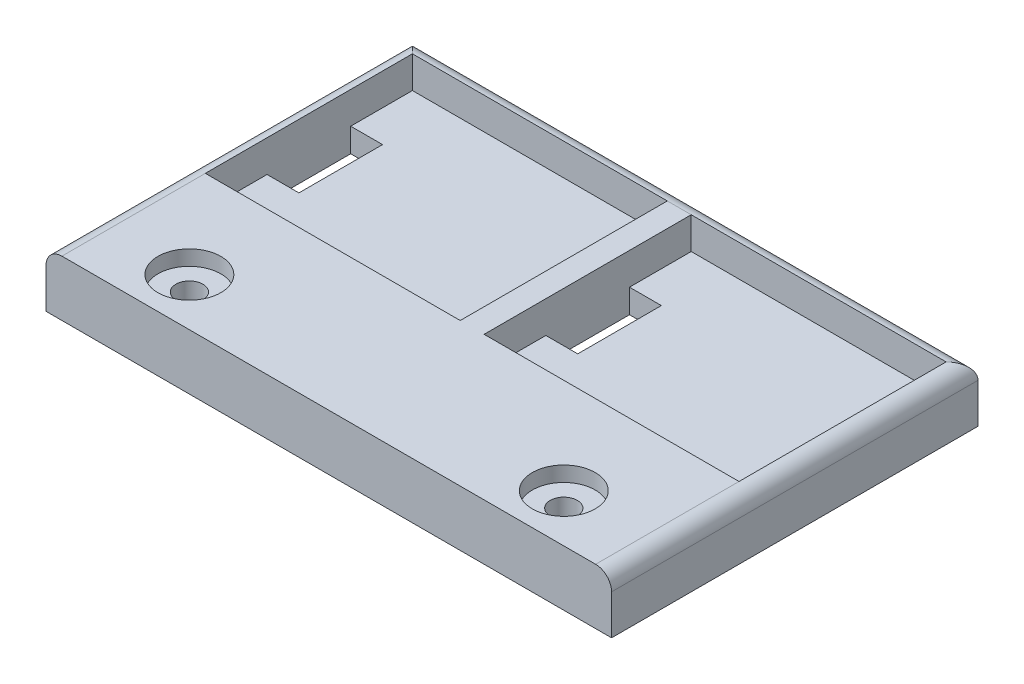
from build123d import *

# Parameters (mm, degrees)
SKETCH1_W                                     = 71
SKETCH1_H                                     = 46
BOSS_EXTRUDE1_DEPTH                           = 7
SKETCH2_W                                     = 32
SKETCH2_H                                     = 26
CUT_EXTRUDE1_DEPTH                            = 4
CBORE_FOR_M3_MUSHROOM_HEAD_SCREW1_D           = 3.4
CBORE_FOR_M3_MUSHROOM_HEAD_SCREW1_CBORE_D     = 7.9
CBORE_FOR_M3_MUSHROOM_HEAD_SCREW1_CBORE_DEPTH = 1.9
CUT_EXTRUDE2_DEPTH                            = 43.488233665
CUT_EXTRUDE2_DEPTH_BACK                       = 43.488233665
SKETCH6_W                                     = 4
SKETCH6_H                                     = 10.5
FILLET1_START                                 = -23
FILLET1_DEPTH                                 = 47
FILLET1_START_2                               = -36
FILLET1_2_DEPTH                               = 72
SKETCH8_W                                     = 0.314102564
SKETCH8_H                                     = 3.5
BOSS_EXTRUDE2_DEPTH                           = 0.5
BOSS_EXTRUDE3_DEPTH                           = 0.3


with BuildPart() as part:
    # Sketch1 → Boss-Extrude1 (new body)
    with BuildSketch(Plane(origin=(0, 0, 0), x_dir=(1, 0, 0), z_dir=(0, 1, 0))):
        Rectangle(SKETCH1_W, SKETCH1_H)
    extrude(amount=BOSS_EXTRUDE1_DEPTH)

    # Sketch2 → Cut-Extrude1 (cut)
    with BuildSketch(Plane(origin=(0, 7, 0), x_dir=(1, 0, 0), z_dir=(0, 1, 0))):
        with Locations((-17.5, 8)):
            Rectangle(SKETCH2_W, SKETCH2_H)
        with Locations((17.5, 8)):
            Rectangle(SKETCH2_W, SKETCH2_H)
    extrude(amount=-CUT_EXTRUDE1_DEPTH, mode=Mode.SUBTRACT)

    # CBORE for M3 Mushroom Head Screw1 (through all)
    with Locations(Plane(origin=(0, 7, 0), x_dir=(1, 0, 0), z_dir=(0, 1, 0))):
        with Locations((-23.5, -17), (23.5, -17)):
            CounterBoreHole(CBORE_FOR_M3_MUSHROOM_HEAD_SCREW1_D / 2, CBORE_FOR_M3_MUSHROOM_HEAD_SCREW1_CBORE_D / 2, CBORE_FOR_M3_MUSHROOM_HEAD_SCREW1_CBORE_DEPTH)

    # Sketch6 → Cut-Extrude2 (cut, two sides: drawn at the far end of the back side and taken through both)
    with BuildSketch(Plane(origin=(0, 3, 0), x_dir=(1, 0, 0), z_dir=(0, 1, 0)).offset(-CUT_EXTRUDE2_DEPTH_BACK)):
        with Locations((-31.5, 8)):
            Rectangle(SKETCH6_W, SKETCH6_H)
        with Locations((-3.5, 8)):
            Rectangle(SKETCH6_W, SKETCH6_H)
        with Locations((3.5, 8)):
            Rectangle(SKETCH6_W, SKETCH6_H)
        with Locations((31.5, 8)):
            Rectangle(SKETCH6_W, SKETCH6_H)
    extrude(amount=CUT_EXTRUDE2_DEPTH + CUT_EXTRUDE2_DEPTH_BACK, mode=Mode.SUBTRACT)

    # Fillet1: read off the stored shape, not the designer's step
    # Fillet1 outline → Fillet1 (cut)
    with BuildSketch(Plane.XY.offset(FILLET1_START)):
        with BuildLine():
            Line((35.5, 7), (33.5, 7))
            ThreePointArc((33.5, 7), (34.914213562, 6.414213562), (35.5, 5))
            Line((35.5, 5), (35.5, 7))
        make_face()
        with BuildLine():
            ThreePointArc((-35.5, 5), (-34.914213562, 6.414213562), (-33.5, 7))
            Line((-33.5, 7), (-35.5, 7))
            Line((-35.5, 7), (-35.5, 5))
        make_face()
    extrude(amount=FILLET1_DEPTH, mode=Mode.SUBTRACT)

    # Fillet1 2 outline → Fillet1 2 (cut)
    with BuildSketch(Plane.YZ.offset(FILLET1_START_2)):
        with BuildLine():
            Line((7, -23), (7, -21))
            ThreePointArc((7, -21), (6.414213562, -22.414213562), (5, -23))
            Line((5, -23), (7, -23))
        make_face()
    extrude(amount=FILLET1_2_DEPTH, mode=Mode.SUBTRACT)

    # Sketch8 → Boss-Extrude2 (add)
    # profile 1 of 6: a face of its own
    with BuildSketch(Plane(origin=(0, 0, 0), x_dir=(1, 0, 0), z_dir=(0, 1, 0))):
        Polygon((-15.099358974, 15.715515127), (-15.099358974, 19.215515127), (-15.165264423, 19.215515127), (-17.477564103, 16.460807595), (-17.477564103, 19.215515127), (-17.791666667, 19.215515127), (-17.791666667, 15.715515127), (-17.720152244, 15.715515127), (-15.413461538, 18.463912563), (-15.413461538, 15.715515127), align=None)
    # profile 2 of 6: a face of its own
    with BuildSketch(Plane(origin=(0, 0, 0), x_dir=(1, 0, 0), z_dir=(0, 1, 0))):
        with Locations((-10.006410256, 17.465515127)):
            Rectangle(SKETCH8_W, SKETCH8_H)
    # profile 3 of 6: a face of its own
    with BuildSketch(Plane(origin=(0, 0, 0), x_dir=(1, 0, 0), z_dir=(0, 1, 0))):
        Polygon((-3.477564103, 19.215515127), (-5.182692308, 19.215515127), (-5.182692308, 18.856540768), (-3.791666667, 18.856540768), (-3.791666667, 17.779617691), (-5.182692308, 17.779617691), (-5.182692308, 17.420643332), (-3.791666667, 17.420643332), (-3.791666667, 15.715515127), (-3.477564103, 15.715515127), align=None)
    # profile 4 of 6: a face of its own
    with BuildSketch(Plane(origin=(0, 0, 0), x_dir=(1, 0, 0), z_dir=(0, 1, 0))):
        with BuildLine():
            Line((4.150641026, 15.715515127), (4.150641026, 19.215515127))
            Line((4.150641026, 19.215515127), (3.443910256, 19.215515127))
            add(Edge.make_bspline(
                [(3.443910256, 19.215515127), (3.382441268, 19.215072557), (3.263683503, 19.214217514), (3.092071055, 19.208796123), (2.933287293, 19.199205657), (2.787854434, 19.185236131), (2.655373222, 19.168083097), (2.536214614, 19.146582693), (2.429762471, 19.121194522), (2.36429303, 19.099549072), (2.333333333, 19.089313204)],
                knots=[0, 0, 0, 0, 1.314313732, 2.53924729, 3.670748893, 4.714932338, 5.66265055, 6.526160246, 7.303039223, 8, 8, 8, 8], degree=3))
            add(Edge.make_bspline(
                [(2.333333333, 19.089313204), (2.292838594, 19.073882498), (2.212767402, 19.043371004), (2.098760279, 18.985814703), (1.991434916, 18.920601601), (1.890215771, 18.847645738), (1.797414945, 18.76488139), (1.709407048, 18.675824304), (1.629792324, 18.577235964), (1.556884028, 18.471160976), (1.491148369, 18.358848924), (1.434009211, 18.240513815), (1.386555218, 18.116756607), (1.347161991, 17.987921459), (1.316115534, 17.853725081), (1.294933602, 17.714011215), (1.280962612, 17.569332026), (1.279558561, 17.471157562), (1.278846154, 17.421344454)],
                knots=[0, 0, 0, 0, 0.984719456, 1.947108742, 2.898477687, 3.838006223, 4.779231079, 5.722358779, 6.681677486, 7.655904652, 8.64651281, 9.637519902, 10.640069247, 11.656948941, 12.698408672, 13.768548281, 14.867775369, 16, 16, 16, 16], degree=3))
            add(Edge.make_bspline(
                [(1.278846154, 17.421344454), (1.279475121, 17.378083215), (1.280714567, 17.292832426), (1.291843883, 17.167191531), (1.308020203, 17.045277959), (1.333064401, 16.927672259), (1.363466915, 16.813344041), (1.402431066, 16.703511797), (1.447066562, 16.597167988), (1.499116441, 16.495750512), (1.556257826, 16.39966714), (1.617579569, 16.309091611), (1.683016264, 16.22531639), (1.753191897, 16.148087778), (1.827199614, 16.077522199), (1.905523944, 16.013030184), (1.988366995, 15.955873629), (2.075357718, 15.903806521), (2.169033847, 15.858386165), (2.271169713, 15.819956155), (2.382200891, 15.78810954), (2.501854848, 15.761538644), (2.630338326, 15.740461342), (2.767777292, 15.726334949), (2.913960581, 15.716782016), (3.014339847, 15.715945623), (3.066005609, 15.715515127)],
                knots=[0, 0, 0, 0, 1.105936401, 2.179363191, 3.223086493, 4.248585256, 5.251745608, 6.245858792, 7.225916811, 8.198733463, 9.158002045, 10.082870192, 10.993790845, 11.873723703, 12.748670949, 13.606408763, 14.465103618, 15.319838547, 16.196477973, 17.123216899, 18.106603292, 19.147568657, 20.255746949, 21.433717677, 22.679120308, 24, 24, 24, 24], degree=3))
            Line((3.066005609, 15.715515127), (4.150641026, 15.715515127))
        make_face()
        with BuildLine():
            Line((3.836538462, 16.074489486), (3.434795673, 16.074489486))
            add(Edge.make_bspline(
                [(3.434795673, 16.074489486), (3.377067302, 16.074737582), (3.266034504, 16.075214762), (3.106376507, 16.079401965), (2.96049711, 16.086243903), (2.828375601, 16.095818981), (2.710086576, 16.108487596), (2.605382827, 16.122612499), (2.514607568, 16.14020995), (2.459678131, 16.156160909), (2.434294872, 16.163531954)],
                knots=[0, 0, 0, 0, 1.375205317, 2.645023457, 3.804390687, 4.853969522, 5.800190428, 6.637939096, 7.370582563, 8, 8, 8, 8], degree=3))
            add(Edge.make_bspline(
                [(2.434294872, 16.163531954), (2.40234651, 16.174783512), (2.339212872, 16.197017885), (2.248331786, 16.237575546), (2.163574782, 16.285617616), (2.083464756, 16.33901989), (2.009138101, 16.399665892), (1.939713985, 16.466236881), (1.875332183, 16.539071656), (1.816657875, 16.618079818), (1.764149571, 16.702769613), (1.718678342, 16.792308447), (1.67882681, 16.885715257), (1.647548218, 16.984424416), (1.623032633, 17.087553474), (1.605667946, 17.195109687), (1.594853221, 17.307072969), (1.593591773, 17.383225094), (1.592948718, 17.422045576)],
                knots=[0, 0, 0, 0, 0.998632004, 1.973411704, 2.929992603, 3.868527914, 4.809262121, 5.754881198, 6.702106254, 7.672490631, 8.653608572, 9.636854334, 10.631411391, 11.644891563, 12.686317036, 13.754757253, 14.855430412, 16, 16, 16, 16], degree=3))
            add(Edge.make_bspline(
                [(1.592948718, 17.422045576), (1.593462005, 17.462979056), (1.594470363, 17.54339324), (1.607144673, 17.661383935), (1.625666229, 17.774864586), (1.652449915, 17.883842781), (1.686580794, 17.988531134), (1.729175435, 18.088350644), (1.777842055, 18.184355513), (1.835745392, 18.274329878), (1.899160985, 18.359422988), (1.969538864, 18.437377903), (2.045760903, 18.508372203), (2.126995752, 18.573511516), (2.215532851, 18.630175192), (2.309286542, 18.680861873), (2.409632213, 18.723877764), (2.479444909, 18.746756627), (2.514923878, 18.758383717)],
                knots=[0, 0, 0, 0, 1.122418816, 2.205001699, 3.251619955, 4.274784885, 5.280384055, 6.268708349, 7.249350384, 8.229342522, 9.199999885, 10.157847722, 11.105861043, 12.055065948, 13.010012805, 13.98527497, 14.976112212, 16, 16, 16, 16], degree=3))
            add(Edge.make_bspline(
                [(2.514923878, 18.758383717), (2.544275025, 18.766500144), (2.606683615, 18.783757897), (2.708523079, 18.80258327), (2.823138228, 18.819187769), (2.951037929, 18.833245808), (3.092076389, 18.843333129), (3.246362077, 18.850904444), (3.413961681, 18.856011076), (3.530144215, 18.856359784), (3.590444712, 18.856540768)],
                knots=[0, 0, 0, 0, 0.674548936, 1.434276114, 2.292660221, 3.240891867, 4.284742987, 5.42552168, 6.663806718, 8, 8, 8, 8], degree=3))
            Line((3.590444712, 18.856540768), (3.836538462, 18.856540768))
            Line((3.836538462, 18.856540768), (3.836538462, 16.074489486))
        make_face(mode=Mode.SUBTRACT)
    # profile 5 of 6: a face of its own
    with BuildSketch(Plane(origin=(0, 0, 0), x_dir=(1, 0, 0), z_dir=(0, 1, 0))):
        Polygon((10.791666667, 19.215515127), (8.817307692, 19.215515127), (8.817307692, 18.856540768), (10.477564103, 18.856540768), (10.477564103, 17.779617691), (8.817307692, 17.779617691), (8.817307692, 17.420643332), (10.477564103, 17.420643332), (10.477564103, 16.074489486), (8.817307692, 16.074489486), (8.817307692, 15.715515127), (10.791666667, 15.715515127), align=None)
    # profile 6 of 6: a face of its own
    with BuildSketch(Plane(origin=(0, 0, 0), x_dir=(1, 0, 0), z_dir=(0, 1, 0))):
        with BuildLine():
            Line((17.791666667, 19.215515127), (17.091245994, 19.215515127))
            add(Edge.make_bspline(
                [(17.091245994, 19.215515127), (17.044504865, 19.215359541), (16.954756721, 19.215060799), (16.82618345, 19.213395036), (16.709356353, 19.20862068), (16.604336514, 19.204512096), (16.511125859, 19.197020155), (16.429438568, 19.189859508), (16.359650871, 19.180485847), (16.317405019, 19.171780424), (16.298277244, 19.167838845)],
                knots=[0, 0, 0, 0, 1.410062039, 2.707475311, 3.878576406, 4.937260626, 5.877586885, 6.699081471, 7.410979367, 8, 8, 8, 8], degree=3))
            add(Edge.make_bspline(
                [(16.298277244, 19.167838845), (16.272670619, 19.161512079), (16.22200363, 19.148993516), (16.149053564, 19.122533915), (16.07953924, 19.09191429), (16.013749416, 19.05595057), (15.952013624, 19.01437579), (15.893695314, 18.967907668), (15.83852985, 18.916800462), (15.78874822, 18.859765621), (15.741809168, 18.799929111), (15.702220542, 18.735225354), (15.668094062, 18.667563827), (15.640923545, 18.596256409), (15.619045572, 18.521994637), (15.603619332, 18.44410584), (15.594368145, 18.362944865), (15.593426289, 18.307586956), (15.592948718, 18.279517531)],
                knots=[0, 0, 0, 0, 1.027469482, 2.033020251, 3.019912614, 3.986113645, 4.951240523, 5.91722682, 6.890402269, 7.87763091, 8.8651537, 9.85103654, 10.82876324, 11.815024772, 12.821070561, 13.842952187, 14.906261191, 16, 16, 16, 16], degree=3))
            add(Edge.make_bspline(
                [(15.592948718, 18.279517531), (15.594417716, 18.232882426), (15.597284112, 18.141885258), (15.624009216, 18.009824377), (15.667785735, 17.886635062), (15.728109024, 17.772472424), (15.8049285, 17.669561779), (15.897253291, 17.579171324), (16.005134903, 17.503531411), (16.105564219, 17.451078606), (16.194278418, 17.417485698), (16.267311731, 17.393849339), (16.346978708, 17.375587373), (16.432516043, 17.359227242), (16.524279699, 17.346875547), (16.622049738, 17.337828953), (16.72589589, 17.332174904), (16.797234959, 17.331332899), (16.833934295, 17.330899742)],
                knots=[0, 0, 0, 0, 1.260483769, 2.459530307, 3.627416485, 4.787058657, 5.939039949, 7.08810263, 8.267026773, 9.491475466, 10.141966685, 10.831826277, 11.566392101, 12.351337768, 13.187381173, 14.07005841, 15.007169909, 16, 16, 16, 16], degree=3))
            Line((16.833934295, 17.330899742), (15.548076923, 15.715515127))
            Line((15.548076923, 15.715515127), (15.936498397, 15.715515127))
            Line((15.936498397, 15.715515127), (17.222355769, 17.330899742))
            Line((17.222355769, 17.330899742), (17.477564103, 17.330899742))
            Line((17.477564103, 17.330899742), (17.477564103, 15.715515127))
            Line((17.477564103, 15.715515127), (17.791666667, 15.715515127))
            Line((17.791666667, 15.715515127), (17.791666667, 19.215515127))
        make_face()
        with BuildLine():
            Line((17.477564103, 18.856540768), (17.477564103, 17.689874101))
            Line((17.477564103, 17.689874101), (16.836738782, 17.684966249))
            add(Edge.make_bspline(
                [(16.836738782, 17.684966249), (16.806818743, 17.684953012), (16.748825186, 17.684927356), (16.664924521, 17.688921132), (16.58680441, 17.69346445), (16.514763657, 17.700413796), (16.448770082, 17.709369867), (16.388856669, 17.720572852), (16.334925617, 17.733624914), (16.272027078, 17.75382654), (16.201790547, 17.785832558), (16.125459087, 17.832398057), (16.060456749, 17.890967176), (16.005538887, 17.957940632), (15.961409456, 18.031576881), (15.930297401, 18.11099325), (15.910554959, 18.194184848), (15.908226414, 18.251362956), (15.907051282, 18.280218652)],
                knots=[0, 0, 0, 0, 1.146690395, 2.22261258, 3.21895312, 4.145990853, 4.996080663, 5.770904154, 6.481378293, 7.121626537, 8.300444488, 9.431385265, 10.535395872, 11.636531494, 12.74115979, 13.810798291, 14.895190096, 16, 16, 16, 16], degree=3))
            add(Edge.make_bspline(
                [(15.907051282, 18.280218652), (15.908253403, 18.308365226), (15.910635568, 18.364141465), (15.930084337, 18.445797375), (15.962973718, 18.522864325), (16.007295956, 18.59502881), (16.061295111, 18.660534546), (16.124612924, 18.716581699), (16.195518119, 18.762831164), (16.261789317, 18.792385544), (16.32102353, 18.810505398), (16.37245319, 18.823256561), (16.430564668, 18.83350103), (16.495640126, 18.841709091), (16.567401757, 18.848764036), (16.646212408, 18.853515814), (16.731549188, 18.856329678), (16.79069612, 18.856468767), (16.821314103, 18.856540768)],
                knots=[0, 0, 0, 0, 1.101028733, 2.181837193, 3.264309656, 4.369019818, 5.486613113, 6.575447106, 7.666700264, 8.788928104, 9.402425223, 10.0903467, 10.862060571, 11.710948788, 12.657782767, 13.684531032, 14.801375019, 16, 16, 16, 16], degree=3))
            Line((16.821314103, 18.856540768), (17.477564103, 18.856540768))
        make_face(mode=Mode.SUBTRACT)
    extrude(amount=-BOSS_EXTRUDE2_DEPTH)

    # Sketch10 → Boss-Extrude3 (add)
    with BuildSketch(Plane(origin=(6.581257784, 0, -4.585249846), x_dir=(1, 0, 0), z_dir=(0, -1, 0))):
        with BuildLine():
            Line((17.638611625, -10.905420188), (17.638611625, -14.905420188))
            add(Edge.make_bspline(
                [(17.638611625, -14.905420188), (18.93936355, -15.549697122), (22.634511172, -12.902808916), (18.93727837, -10.266365797), (17.638611625, -10.905420188)],
                knots=[0.119213748, 0.119213748, 0.119213748, 0.119213748, 0.284024774, 0.448835801, 0.448835801, 0.448835801, 0.448835801], degree=3))
        make_face()
        with BuildLine():
            add(Edge.make_bspline(
                [(15.544041096, -13.205420188), (16.042955643, -12.943821706), (16.697730938, -14.43939149), (17.638611625, -14.905420188)],
                knots=[0, 0, 0, 0, 0.119213748, 0.119213748, 0.119213748, 0.119213748], degree=3))
            Line((17.638611625, -14.905420188), (17.638611625, -10.905420188))
            add(Edge.make_bspline(
                [(17.638611625, -10.905420188), (16.695609548, -11.36945734), (15.477286366, -14.160534115), (14.75003752, -10.839229702), (14.30781462, -10.605420188)],
                knots=[0.448835801, 0.448835801, 0.448835801, 0.448835801, 0.568510183, 0.672105129, 0.672105129, 0.672105129, 0.672105129], degree=3))
            Line((14.30781462, -10.605420188), (14.36280232, -15.205420188))
            add(Edge.make_bspline(
                [(14.36280232, -15.205420188), (14.800420217, -14.958678469), (15.114453185, -13.43066827), (15.544041096, -13.205420188)],
                knots=[0.89735159, 0.89735159, 0.89735159, 0.89735159, 1, 1, 1, 1], degree=3))
        make_face()
        with BuildLine():
            Line((14.36280232, -15.205420188), (14.30781462, -10.605420188))
            add(Edge.make_bspline(
                [(14.30781462, -10.605420188), (13.829285388, -10.352415), (12.621218784, -12.919742236), (13.880428617, -15.477396534), (14.36280232, -15.205420188)],
                knots=[0.672105129, 0.672105129, 0.672105129, 0.672105129, 0.784205181, 0.89735159, 0.89735159, 0.89735159, 0.89735159], degree=3))
        make_face()
    extrude(amount=BOSS_EXTRUDE3_DEPTH)


solid = part.part
